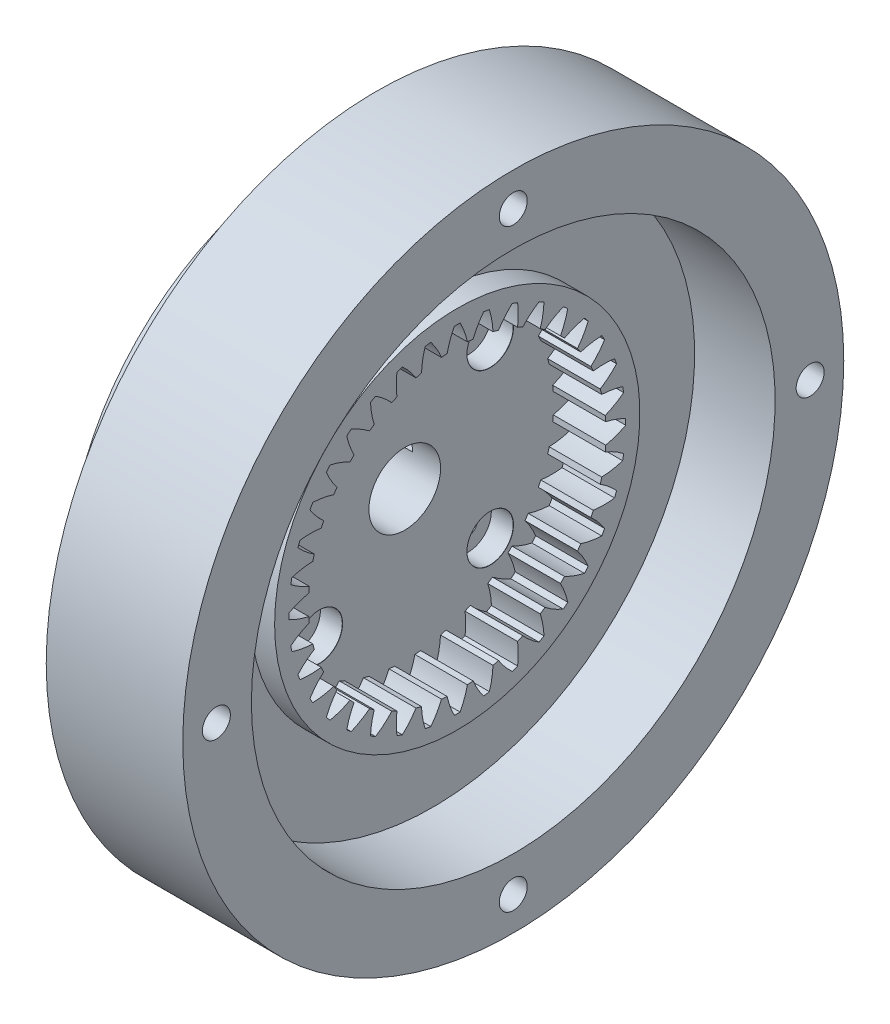
from build123d import *

# Parameters (mm, degrees)
BASPROSKE_W                                         = 9.525
BASPROSKE_H                                         = 3.598545
TOOTHCUT_DEPTH                                      = 45.291510727
TEETHCUTS_COUNT                                     = 36
EXTRUDE_THIN1_START                                 = 9.525
SKETCH3_R                                           = 33.126045
SKETCH3_R_2                                         = 30.586045
EXTRUDE_THIN1_DEPTH                                 = 9.525
EXTRUDE_THIN2_START                                 = 5.08
SKETCH4_R                                           = 39.476045
SKETCH4_R_2                                         = 33.126045
EXTRUDE_THIN2_DEPTH                                 = 5.08
BOSS_EXTRUDE2_START                                 = -5.08
SKETCH9_R                                           = 59.944
SKETCH9_R_2                                         = 39.476045
BOSS_EXTRUDE2_DEPTH                                 = 5.08
SKETCH12_R                                          = 59.944
BOSS_EXTRUDE3_DEPTH                                 = 5.08
SKETCH13_R                                          = 20.2565
SKETCH13_R_2                                        = 17.9705
CUT_EXTRUDE10_DEPTH                                 = 2.032
CUT_EXTRUDE11_DEPTH                                 = 87.022510409
CUT_EXTRUDE11_DEPTH_BACK                            = 87.022510409
SKETCH14_R                                          = 3.302
BOSS_EXTRUDE5_START                                 = 14.605
SKETCH15_R                                          = 59.944
SKETCH15_R_2                                        = 47.498
BOSS_EXTRUDE5_DEPTH                                 = 14.605
CBORE_FOR_00_BINDING_HEAD_MACHINE_SCREW_D           = 5.08
CBORE_FOR_00_BINDING_HEAD_MACHINE_SCREW_CBORE_D     = 7.62
CBORE_FOR_00_BINDING_HEAD_MACHINE_SCREW_CBORE_DEPTH = 1.27
SKETCH21_R                                          = 19.05
CUT_EXTRUDE12_DEPTH                                 = 1.524
SKETCH26_R                                          = 7.62
CUT_EXTRUDE15_DEPTH                                 = 88.901708476
BOSS_EXTRUDE8_START                                 = 1.524
SKETCH28_R                                          = 19.05
SKETCH28_R_2                                        = 7.62
BOSS_EXTRUDE8_DEPTH                                 = 1.524
SKETCH29_R                                          = 44.45
BOSS_EXTRUDE9_DEPTH                                 = 11.62
SKETCH31_W                                          = 15.24
SKETCH31_H                                          = 50.8
CUT_EXTRUDE17_DEPTH                                 = 11.62
SKETCH32_R                                          = 11.5
CUT_EXTRUDE18_DEPTH                                 = 2
BOSS_EXTRUDE14_START                                = 2.032
SKETCH38_R                                          = 20.2565
SKETCH38_R_2                                        = 17.9705
BOSS_EXTRUDE14_DEPTH                                = 2.032
CBORE_FOR_M3_HEX_HEAD_MACHINE_SCREW1_AT_COUNT       = 2
CBORE_FOR_M3_HEX_HEAD_MACHINE_SCREW1_AT_PITCH       = 31
CBORE_FOR_M3_HEX_HEAD_MACHINE_SCREW1_2_COUNT        = 2
CBORE_FOR_M3_HEX_HEAD_MACHINE_SCREW1_2_PITCH        = 43.840620434
CBORE_FOR_M3_HEX_HEAD_MACHINE_SCREW1_3_COUNT        = 2
CBORE_FOR_M3_HEX_HEAD_MACHINE_SCREW1_3_PITCH        = 31
SKETCH41_R                                          = 7.62
CUT_EXTRUDE21_DEPTH                                 = 89.316881155
BOSS_EXTRUDE15_START                                = -14.7
SKETCH42_R                                          = 7.62
SKETCH42_R_2                                        = 3
BOSS_EXTRUDE15_DEPTH                                = 14.7
BOSS_EXTRUDE16_START                                = 9.62
BOSS_EXTRUDE16_DEPTH                                = 9.62
SKETCH45_W                                          = 6
SKETCH45_H                                          = 25.4
CUT_EXTRUDE22_DEPTH                                 = 9.62
SKETCH46_W                                          = 15.24
SKETCH46_H                                          = 26.202546501
CUT_EXTRUDE23_DEPTH                                 = 9.62
CUT_EXTRUDE24_START                                 = -14.7
SKETCH47_R                                          = 6.5
CUT_EXTRUDE24_DEPTH                                 = 14.7
FILLET1_R                                           = 2.54


with BuildPart() as part:
    # BasProSke → Base-Revolve (revolve)
    with BuildSketch(Plane(origin=(0, 0, 0), x_dir=(1, 0, 0), z_dir=(0, 1, 0)), mode=Mode.PRIVATE) as base_revolve_sk:
        with Locations((4.7625, 28.7867725)):
            Rectangle(BASPROSKE_W, BASPROSKE_H)
    revolve(base_revolve_sk.sketch.rotate(Axis((-10, 0, 0), (1, 0, 0)), 180), axis=Axis((-10, 0, 0), (1, 0, 0)))

    # TooCutSke → ToothCut (cut, through all)
    with BuildSketch(Plane(origin=(0, 0, 0), x_dir=(0, 0, -1), z_dir=(1, 0, 0))):
        with BuildLine():
            ThreePointArc((1.841725032, 26.899124248), (1.308199168, 28.772624617), (0.524789557, 30.556138806))
            ThreePointArc((0.524789557, 30.556138806), (0, 30.560645), (-0.524789557, 30.556138806))
            ThreePointArc((-0.524789557, 30.556138806), (-1.308199168, 28.772624617), (-1.841725032, 26.899124248))
            ThreePointArc((-1.841725032, 26.899124248), (0, 26.9621), (1.841725032, 26.899124248))
        make_face()
    toothcut = extrude(amount=TOOTHCUT_DEPTH, mode=Mode.SUBTRACT)

    # TeethCuts: ToothCut ×36 about axis
    teethcuts_axis = Axis((0, 0, 0), (1, 0, 0))
    for i in range(1, TEETHCUTS_COUNT):
        add(toothcut.rotate(teethcuts_axis, i * 360 / TEETHCUTS_COUNT), mode=Mode.SUBTRACT)

    # Sketch3 → Extrude-Thin1 (add)
    with BuildSketch(Plane(origin=(0, 0, 0), x_dir=(0, 0, -1), z_dir=(1, 0, 0)).offset(EXTRUDE_THIN1_START)):
        Circle(SKETCH3_R)
        Circle(SKETCH3_R_2, mode=Mode.SUBTRACT)
    extrude(amount=-EXTRUDE_THIN1_DEPTH)

    # Sketch4 → Extrude-Thin2 (add)
    with BuildSketch(Plane(origin=(0, 0, 0), x_dir=(0, 0, -1), z_dir=(1, 0, 0)).offset(EXTRUDE_THIN2_START)):
        Circle(SKETCH4_R)
        Circle(SKETCH4_R_2, mode=Mode.SUBTRACT)
    extrude(amount=-EXTRUDE_THIN2_DEPTH)

    # Sketch9 → Boss-Extrude2 (add)
    with BuildSketch(Plane.ZY.offset(BOSS_EXTRUDE2_START)):
        Circle(SKETCH9_R)
        Circle(SKETCH9_R_2, mode=Mode.SUBTRACT)
    extrude(amount=BOSS_EXTRUDE2_DEPTH)

    # Sketch12 → Boss-Extrude3 (add)
    with BuildSketch(Plane.ZY):
        Circle(SKETCH12_R)
    extrude(amount=BOSS_EXTRUDE3_DEPTH)

    # Sketch13 → Cut-Extrude10 (cut)
    with BuildSketch(Plane(origin=(0, 0, 0), x_dir=(0, 0, -1), z_dir=(1, 0, 0))):
        Circle(SKETCH13_R)
        Circle(SKETCH13_R_2, mode=Mode.SUBTRACT)
    extrude(amount=-CUT_EXTRUDE10_DEPTH, mode=Mode.SUBTRACT)

    # Sketch14 → Cut-Extrude11 (cut, two sides: drawn at the far end of the back side and taken through both)
    with BuildSketch(Plane.ZY.offset(5.08).offset(-CUT_EXTRUDE11_DEPTH_BACK)):
        Circle(SKETCH14_R)
    extrude(amount=CUT_EXTRUDE11_DEPTH + CUT_EXTRUDE11_DEPTH_BACK, mode=Mode.SUBTRACT)

    # Sketch15 → Boss-Extrude5 (add)
    with BuildSketch(Plane(origin=(5.08, 0, 0), x_dir=(0, 0, -1), z_dir=(1, 0, 0)).offset(BOSS_EXTRUDE5_START)):
        with Locations(Location((0, 0, 0), (0, 0, 180))):
            Circle(SKETCH15_R)
        with Locations(Location((0, 0, 0), (0, 0, 180))):
            Circle(SKETCH15_R_2, mode=Mode.SUBTRACT)
    extrude(amount=-BOSS_EXTRUDE5_DEPTH)

    # CBORE for #00 Binding Head Machine Screw1 (through all)
    with Locations(Plane.ZY.offset(5.08)):
        with Locations((0, 53.848), (53.848, 0), (0, -53.848), (-53.848, 0)):
            CounterBoreHole(CBORE_FOR_00_BINDING_HEAD_MACHINE_SCREW_D / 2, CBORE_FOR_00_BINDING_HEAD_MACHINE_SCREW_CBORE_D / 2, CBORE_FOR_00_BINDING_HEAD_MACHINE_SCREW_CBORE_DEPTH)

    # Sketch21 → Cut-Extrude12 (cut)
    with BuildSketch(Plane.ZY.offset(5.08)):
        Circle(SKETCH21_R)
    extrude(amount=-CUT_EXTRUDE12_DEPTH, mode=Mode.SUBTRACT)

    # Sketch26 → Cut-Extrude15 (cut, through all)
    with BuildSketch(Plane.ZY.offset(3.556)):
        Circle(SKETCH26_R)
    extrude(amount=-CUT_EXTRUDE15_DEPTH, mode=Mode.SUBTRACT)

    # Sketch28 → Boss-Extrude8 (add)
    with BuildSketch(Plane.ZY.offset(3.556).offset(BOSS_EXTRUDE8_START)):
        Circle(SKETCH28_R)
        Circle(SKETCH28_R_2, mode=Mode.SUBTRACT)
    extrude(amount=-BOSS_EXTRUDE8_DEPTH)

    # Sketch29 → Boss-Extrude9 (add)
    with BuildSketch(Plane.ZY.offset(5.08)):
        Circle(SKETCH29_R)
    extrude(amount=BOSS_EXTRUDE9_DEPTH)

    # Sketch31 → Cut-Extrude17 (cut)
    with BuildSketch(Plane.ZY.offset(16.7)):
        with Locations((0, 25.4)):
            Rectangle(SKETCH31_W, SKETCH31_H)
    extrude(amount=-CUT_EXTRUDE17_DEPTH, mode=Mode.SUBTRACT)

    # Sketch32 → Cut-Extrude18 (cut)
    with BuildSketch(Plane.ZY.offset(16.7)):
        Circle(SKETCH32_R)
    extrude(amount=-CUT_EXTRUDE18_DEPTH, mode=Mode.SUBTRACT)

    # Sketch38 → Boss-Extrude14 (add)
    with BuildSketch(Plane(origin=(-2.032, 0, 0), x_dir=(0, 0, -1), z_dir=(1, 0, 0)).offset(BOSS_EXTRUDE14_START)):
        Circle(SKETCH38_R)
        Circle(SKETCH38_R_2, mode=Mode.SUBTRACT)
    extrude(amount=-BOSS_EXTRUDE14_DEPTH)

    # Sketch40 → CBORE for M3 Hex Head Machine Screw1 (revolve, cut)
    with BuildSketch(Plane(origin=(0, 15.5, -15.5), x_dir=(0, 0, -1), z_dir=(0, 1, 0))):
        Polygon((0, 0), (0, 16.7), (1.7, 16.7), (1.7, 4), (4.2, 4), (4.2, 0.025), (4.225, 0), align=None)
    cbore_for_m3_hex_head_machine_screw1 = revolve(axis=Axis((6.35, 15.5, -15.5), (-1, 0, 0)), mode=Mode.SUBTRACT)

    # CBORE for M3 Hex Head Machine Screw1 at: CBORE for M3 Hex Head Machine Screw1 ×2
    with Locations(*[(0, 0, i * CBORE_FOR_M3_HEX_HEAD_MACHINE_SCREW1_AT_PITCH) for i in range(1, CBORE_FOR_M3_HEX_HEAD_MACHINE_SCREW1_AT_COUNT)]):
        add(cbore_for_m3_hex_head_machine_screw1, mode=Mode.SUBTRACT)

    # CBORE for M3 Hex Head Machine Screw1 2: CBORE for M3 Hex Head Machine Screw1 ×2
    with Locations(*[Vector(0, -0.7071067811865476, 0.7071067811865476) * (i * CBORE_FOR_M3_HEX_HEAD_MACHINE_SCREW1_2_PITCH) for i in range(1, CBORE_FOR_M3_HEX_HEAD_MACHINE_SCREW1_2_COUNT)]):
        add(cbore_for_m3_hex_head_machine_screw1, mode=Mode.SUBTRACT)

    # CBORE for M3 Hex Head Machine Screw1 3: CBORE for M3 Hex Head Machine Screw1 ×2
    with Locations(*[(0, -i * CBORE_FOR_M3_HEX_HEAD_MACHINE_SCREW1_3_PITCH, 0) for i in range(1, CBORE_FOR_M3_HEX_HEAD_MACHINE_SCREW1_3_COUNT)]):
        add(cbore_for_m3_hex_head_machine_screw1, mode=Mode.SUBTRACT)

    # Sketch41 → Cut-Extrude21 (cut, through all)
    with BuildSketch(Plane(origin=(-5.08, 0, 0), x_dir=(0, 0, -1), z_dir=(1, 0, 0))):
        with Locations(Location((0, 0, 0), (0, 0, 180))):
            Circle(SKETCH41_R)
    extrude(amount=-CUT_EXTRUDE21_DEPTH, mode=Mode.SUBTRACT)

    # Sketch42 → Boss-Extrude15 (add)
    with BuildSketch(Plane(origin=(0, 0, 0), x_dir=(0, 0, -1), z_dir=(1, 0, 0)).offset(BOSS_EXTRUDE15_START)):
        Circle(SKETCH42_R)
        Circle(SKETCH42_R_2, mode=Mode.SUBTRACT)
    extrude(amount=BOSS_EXTRUDE15_DEPTH)

    # Sketch43 → Boss-Extrude16 (add)
    with BuildSketch(Plane.ZY.offset(5.08).offset(BOSS_EXTRUDE16_START)):
        with BuildLine():
            Line((-7.62, 0), (-7.62, 8.613106292))
            ThreePointArc((-7.62, 8.613106292), (0, 11.5), (7.62, 8.613106292))
            Line((7.62, 8.613106292), (7.62, 0))
            ThreePointArc((7.62, 0), (0, 7.62), (-7.62, 0))
        make_face()
    extrude(amount=-BOSS_EXTRUDE16_DEPTH)

    # Sketch45 → Cut-Extrude22 (cut)
    with BuildSketch(Plane.ZY.offset(14.7)):
        with Locations((0, 12.7)):
            Rectangle(SKETCH45_W, SKETCH45_H)
    extrude(amount=-CUT_EXTRUDE22_DEPTH, mode=Mode.SUBTRACT)

    # Sketch46 → Cut-Extrude23 (cut)
    with BuildSketch(Plane.ZY.offset(5.08)):
        with Locations((0, 13.101273251)):
            Rectangle(SKETCH46_W, SKETCH46_H)
    extrude(amount=CUT_EXTRUDE23_DEPTH, mode=Mode.SUBTRACT)

    # Sketch47 → Cut-Extrude24 (cut)
    with BuildSketch(Plane(origin=(0, 0, 0), x_dir=(0, 0, -1), z_dir=(1, 0, 0)).offset(CUT_EXTRUDE24_START)):
        Circle(SKETCH47_R)
    extrude(amount=CUT_EXTRUDE24_DEPTH, mode=Mode.SUBTRACT)

    # Fillet1
    fillet1_edges = [part.edges().sort_by_distance(p)[0] for p in [
        (-5.08, -44.45, 0),
    ]]
    fillet(fillet1_edges, radius=FILLET1_R)


solid = part.part
